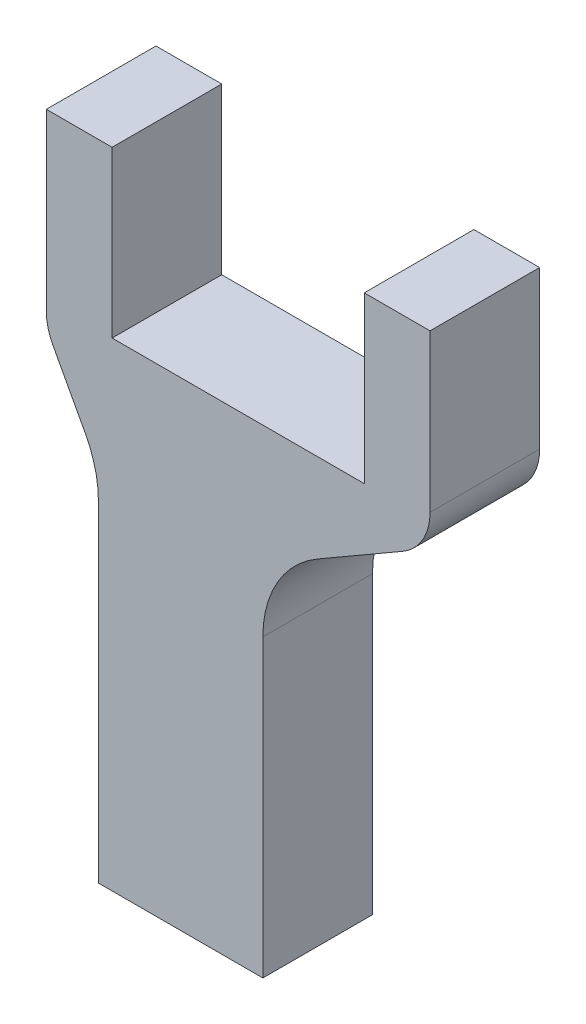
from build123d import *

# Parameters (mm, degrees)
BOSS_EXTRUDE1_DEPTH = 10
FILLET1_R           = 10
FILLET2_R           = 5


with BuildPart() as part:
    # Sketch1 → Boss-Extrude1 (new body)
    with BuildSketch(Plane.XY):
        Polygon((-7.5, 467.320715151), (-7.5, 500.037974444), (-12.25, 508.842566049), (-12.25, 526.07117063), (-6.25, 526.07117063), (-6.25, 511.000207075), (16.75, 511.000207075), (16.75, 526.07117063), (22.75, 526.07117063), (22.75, 508.842566049), (7.5, 500.037974444), (7.5, 467.320715151), align=None)
    extrude(amount=BOSS_EXTRUDE1_DEPTH)

    # Fillet1
    fillet1_edges = [part.edges().sort_by_distance(p)[0] for p in [
        (-7.5, 500.037974444, 5),
        (7.5, 500.037974444, 5),
    ]]
    fillet(fillet1_edges, radius=FILLET1_R)

    # Fillet2
    fillet2_edges = [part.edges().sort_by_distance(p)[0] for p in [
        (-12.25, 508.842566049, 5),
        (22.75, 508.842566049, 5),
    ]]
    fillet(fillet2_edges, radius=FILLET2_R)


solid = part.part
